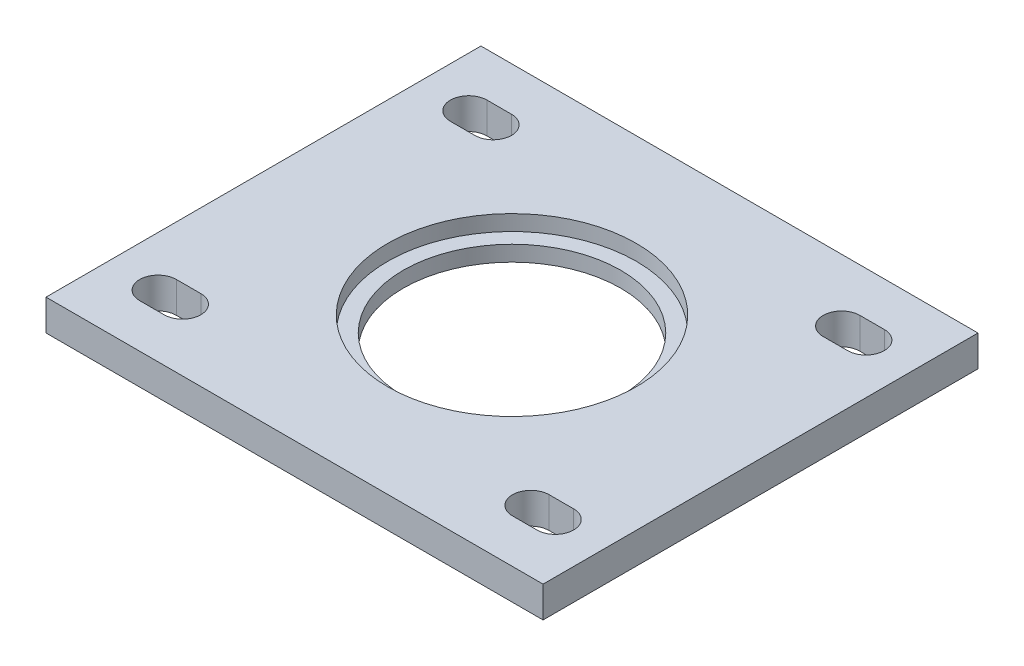
from build123d import *

# Parameters (mm, degrees)
SKETCH1_W           = 101.6
SKETCH1_H           = 88.9
SKETCH1_R           = 25.4
BOSS_EXTRUDE1_DEPTH = 3.175
CUT_EXTRUDE1_DEPTH  = 68.576054376
BOSS_EXTRUDE2_START = 3.175
SKETCH3_W           = 101.6
SKETCH3_H           = 88.9
SKETCH3_R           = 25.4
BOSS_EXTRUDE2_DEPTH = 3.175
SKETCH5_R           = 31.75
SKETCH5_R_2         = 22.225
BOSS_EXTRUDE3_DEPTH = 3.175


with BuildPart() as part:
    # Sketch1 → Boss-Extrude1 (new body)
    with BuildSketch(Plane(origin=(0, 0, 0), x_dir=(1, 0, 0), z_dir=(0, 1, 0))):
        Rectangle(SKETCH1_W, SKETCH1_H)
        Circle(SKETCH1_R, mode=Mode.SUBTRACT)
    extrude(amount=BOSS_EXTRUDE1_DEPTH)

    # Sketch2 → Cut-Extrude1 (cut, through all)
    with BuildSketch(Plane(origin=(0, 3.175, 0), x_dir=(1, 0, 0), z_dir=(0, 1, 0))):
        with BuildLine():
            Line((-40.6, 35.5), (-35.6, 35.5))
            ThreePointArc((-35.6, 35.5), (-31.85, 31.75), (-35.6, 28))
            Line((-35.6, 28), (-40.6, 28))
            ThreePointArc((-40.6, 28), (-44.35, 31.75), (-40.6, 35.5))
        make_face()
        with BuildLine():
            Line((-40.6, -28), (-35.6, -28))
            ThreePointArc((-35.6, -28), (-31.85, -31.75), (-35.6, -35.5))
            Line((-35.6, -35.5), (-40.6, -35.5))
            ThreePointArc((-40.6, -35.5), (-44.35, -31.75), (-40.6, -28))
        make_face()
        with BuildLine():
            Line((35.6, 35.5), (40.6, 35.5))
            ThreePointArc((40.6, 35.5), (44.35, 31.75), (40.6, 28))
            Line((40.6, 28), (35.6, 28))
            ThreePointArc((35.6, 28), (31.85, 31.75), (35.6, 35.5))
        make_face()
        with BuildLine():
            Line((35.6, -28), (40.6, -28))
            ThreePointArc((40.6, -28), (44.35, -31.75), (40.6, -35.5))
            Line((40.6, -35.5), (35.6, -35.5))
            ThreePointArc((35.6, -35.5), (31.85, -31.75), (35.6, -28))
        make_face()
    extrude(amount=-CUT_EXTRUDE1_DEPTH, mode=Mode.SUBTRACT)

    # Sketch3 → Boss-Extrude2 (add)
    with BuildSketch(Plane(origin=(0, 3.175, 0), x_dir=(1, 0, 0), z_dir=(0, 1, 0)).offset(BOSS_EXTRUDE2_START)):
        Rectangle(SKETCH3_W, SKETCH3_H)
        Circle(SKETCH3_R, mode=Mode.SUBTRACT)
        with BuildLine():
            Line((40.6, 35.5), (35.6, 35.5))
            ThreePointArc((35.6, 35.5), (31.85, 31.75), (35.6, 28))
            Line((35.6, 28), (40.6, 28))
            ThreePointArc((40.6, 28), (44.35, 31.75), (40.6, 35.5))
        make_face(mode=Mode.SUBTRACT)
        with BuildLine():
            Line((40.6, -28), (35.6, -28))
            ThreePointArc((35.6, -28), (31.85, -31.75), (35.6, -35.5))
            Line((35.6, -35.5), (40.6, -35.5))
            ThreePointArc((40.6, -35.5), (44.35, -31.75), (40.6, -28))
        make_face(mode=Mode.SUBTRACT)
        with BuildLine():
            Line((-35.6, -28), (-40.6, -28))
            ThreePointArc((-40.6, -28), (-44.35, -31.75), (-40.6, -35.5))
            Line((-40.6, -35.5), (-35.6, -35.5))
            ThreePointArc((-35.6, -35.5), (-31.85, -31.75), (-35.6, -28))
        make_face(mode=Mode.SUBTRACT)
        with BuildLine():
            Line((-35.6, 35.5), (-40.6, 35.5))
            ThreePointArc((-40.6, 35.5), (-44.35, 31.75), (-40.6, 28))
            Line((-40.6, 28), (-35.6, 28))
            ThreePointArc((-35.6, 28), (-31.85, 31.75), (-35.6, 35.5))
        make_face(mode=Mode.SUBTRACT)
    extrude(amount=-BOSS_EXTRUDE2_DEPTH)

    # Sketch5 → Boss-Extrude3 (add)
    with BuildSketch(Plane.XZ):
        Circle(SKETCH5_R)
        Circle(SKETCH5_R_2, mode=Mode.SUBTRACT)
    extrude(amount=-BOSS_EXTRUDE3_DEPTH)


solid = part.part
